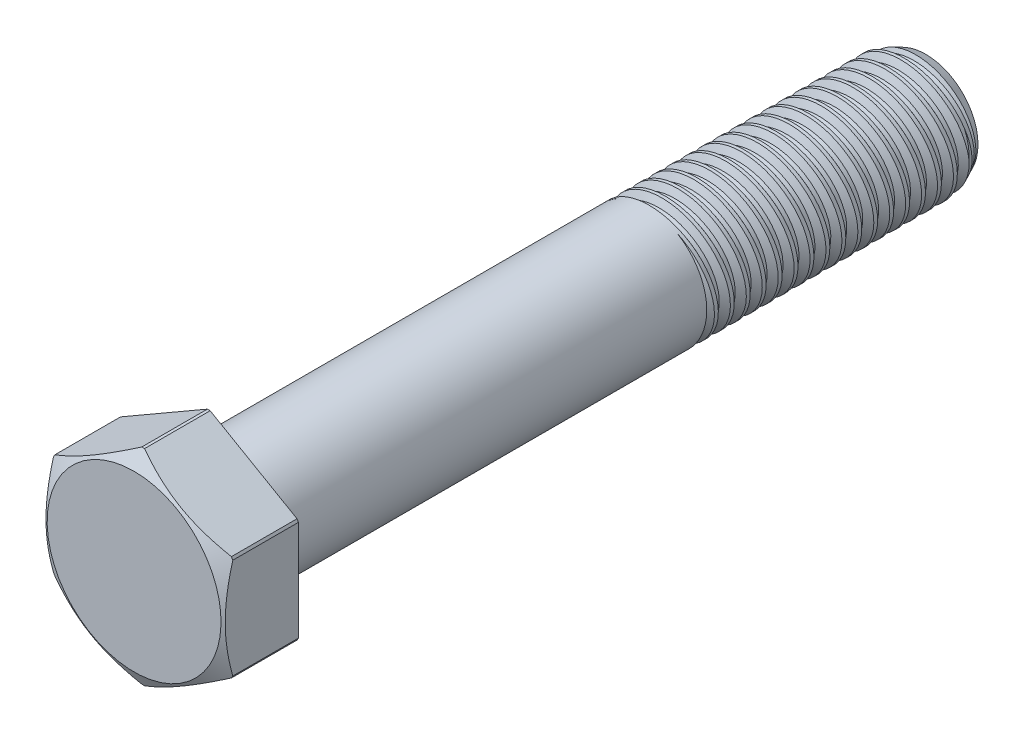
from build123d import *
from build123d.topology import SkipClean

# Parameters (mm, degrees)
SKETCH1_W            = 44.45
SKETCH1_H            = 9.525
LPATTERN1_COUNT      = 2
LPATTERN1_PITCH      = 2.54
LPATTERN1_COUNT_DIR2 = 18
LPATTERN1_PITCH_DIR2 = 2.54
SKETCH4_W            = 69.85
SKETCH4_H            = 9.525
EXTRUDE1_DEPTH       = 11.90625
FILLET1_R            = 1.905


with BuildPart() as part:
    # Sketch1 → Revolve1 (revolve)
    with BuildSketch(Plane(origin=(0, 0, 0), x_dir=(0, 0, -1), z_dir=(1, 0, 0)), mode=Mode.PRIVATE) as revolve1_sk:
        with Locations((22.225, 4.7625)):
            Rectangle(SKETCH1_W, SKETCH1_H)
    revolve(revolve1_sk.sketch.rotate(Axis((0, 0, 0), (0, 0, 1)), 124.89031917), axis=Axis((0, 0, 0), (0, 0, 1)))

    # Sketch2 → Cut-Revolve1 (revolve, cut)
    with BuildSketch(Plane(origin=(0, 0, 0), x_dir=(0, 0, -1), z_dir=(1, 0, 0)), mode=Mode.PRIVATE) as cut_revolve1_sk:
        Polygon((2.517718868, 9.860695849), (0.314714858, 9.566961981), (1.283202713, 8.309111622), (1.91263243, 8.393035584), align=None)
    cut_revolve1 = revolve(cut_revolve1_sk.sketch.rotate(Axis((0, -0.361519207, 0), (0, 0.13216372009101818, -0.9912279006826347)), 180), axis=Axis((0, -0.361519207, 0), (0, 0.13216372009101818, -0.9912279006826347)), mode=Mode.SUBTRACT)

    # Sketch3 → Cut-Revolve2 (revolve, cut)
    with BuildSketch(Plane(origin=(0, 0, 0), x_dir=(0, 0, -1), z_dir=(1, 0, 0)), mode=Mode.PRIVATE) as cut_revolve2_sk:
        Polygon((41.842518959, 9.525), (44.45, 8.309111622), (44.45, 9.525), align=None)
    revolve(cut_revolve2_sk.sketch.rotate(Axis((0, 0, 0), (0, 0, -1)), 235.10968083), axis=Axis((0, 0, 0), (0, 0, -1)), mode=Mode.SUBTRACT)

    # LPattern1: Cut-Revolve1 2 × 18
    with Locations(*[Vector(0, 0, 1) * (i * LPATTERN1_PITCH) + Vector(0, 0, -1) * (j * LPATTERN1_PITCH_DIR2) for i in range(LPATTERN1_COUNT) for j in range(LPATTERN1_COUNT_DIR2) if (i, j) != (0, 0)]):
        add(cut_revolve1, mode=Mode.SUBTRACT)

    # Sketch4 → Revolve2 (revolve)
    with SkipClean():  # the faces are left unmerged after this step: merging them gives an invalid solid
        with BuildSketch(Plane(origin=(0, 0, 0), x_dir=(0, 0, -1), z_dir=(1, 0, 0)), mode=Mode.PRIVATE) as revolve2_sk:
            with Locations((-34.925, 4.7625)):
                Rectangle(SKETCH4_W, SKETCH4_H)
        revolve(revolve2_sk.sketch.rotate(Axis((0, 0, 69.85), (0, 0, 1)), 270), axis=Axis((0, 0, 69.85), (0, 0, 1)))

    # Sketch5 → Extrude1 (add)
    with SkipClean():  # the faces are left unmerged after this step: merging them gives an invalid solid
        with BuildSketch(Plane.XY.offset(69.85)):
            Polygon((0, 16.497783942), (-14.2875, 8.248891971), (-14.2875, -8.248891971), (0, -16.497783942), (14.2875, -8.248891971), (14.2875, 8.248891971), align=None)
        extrude(amount=EXTRUDE1_DEPTH)

    # Sketch6 → Cut-Revolve3 (revolve, cut)
    with SkipClean():  # the faces are left unmerged after this step: merging them gives an invalid solid
        with BuildSketch(Plane(origin=(0, 0, 0), x_dir=(0, 0, -1), z_dir=(1, 0, 0)), mode=Mode.PRIVATE) as cut_revolve3_sk:
            Polygon((-81.75625, 13.858875), (-80.305998696, 16.370783942), (-69.85, 16.370783942), (-69.85, 16.878783942), (-81.75625, 16.878783942), align=None)
        revolve(cut_revolve3_sk.sketch.rotate(Axis((0, 0, 0), (0, 0, 1)), 270), axis=Axis((0, 0, 0), (0, 0, 1)), mode=Mode.SUBTRACT)

    # Fillet1
    fillet1_edges = [part.edges().sort_by_distance(p)[0] for p in [
        (-9.525, 0, 69.85),
    ]]
    fillet(fillet1_edges, radius=FILLET1_R)


solid = part.part
